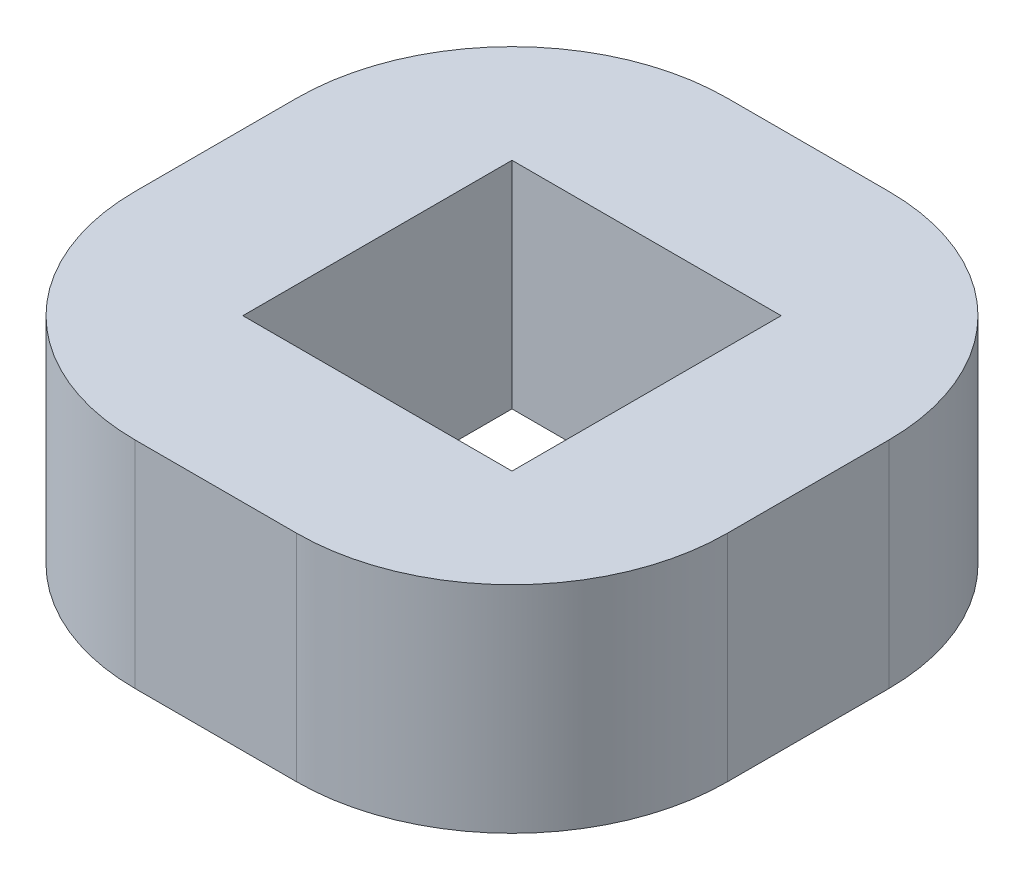
from build123d import *

# Parameters (mm, degrees)
SKETCH1_W           = 55
SKETCH1_H           = 55
SKETCH1_W_2         = 25
SKETCH1_H_2         = 25
BOSS_EXTRUDE1_DEPTH = 20
FILLET1_R           = 20


with BuildPart() as part:
    # Sketch1 → Boss-Extrude1 (new body)
    with BuildSketch(Plane(origin=(0, 0, 0), x_dir=(1, 0, 0), z_dir=(0, 1, 0))):
        Rectangle(SKETCH1_W, SKETCH1_H)
        Rectangle(SKETCH1_W_2, SKETCH1_H_2, mode=Mode.SUBTRACT)
    extrude(amount=BOSS_EXTRUDE1_DEPTH)

    # Fillet1
    fillet1_edges = [part.edges().sort_by_distance(p)[0] for p in [
        (-27.5, 10, -27.5),
        (27.5, 10, -27.5),
        (27.5, 10, 27.5),
        (-27.5, 10, 27.5),
    ]]
    fillet(fillet1_edges, radius=FILLET1_R)


solid = part.part
